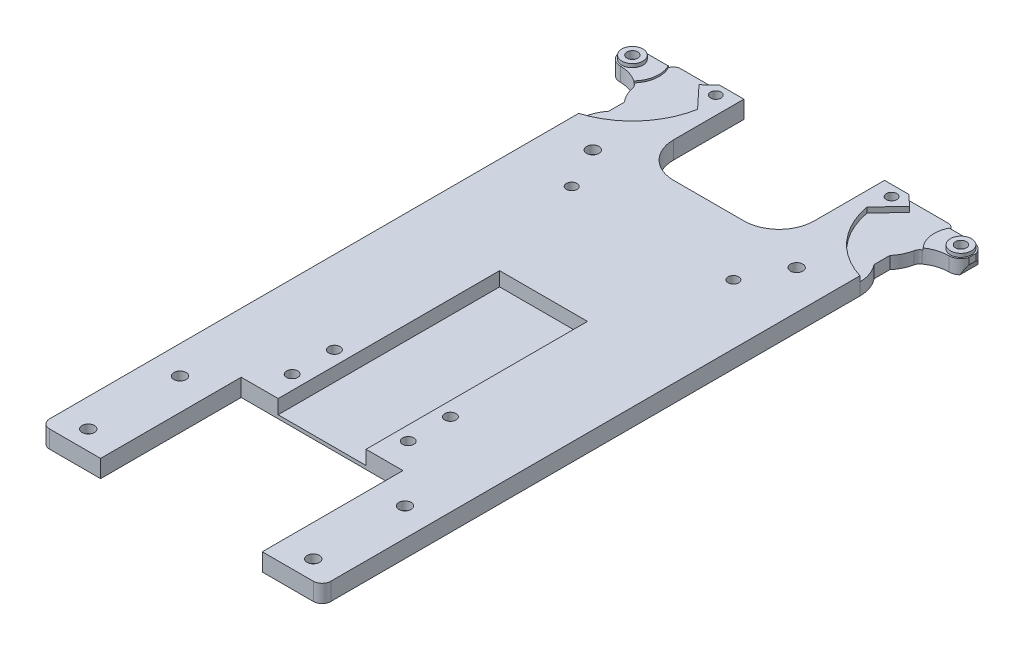
from build123d import *

# Parameters (mm, degrees)
SKETCH2_R                = 1.5
BOSS_EXTRUDE1_DEPTH      = 5
SKETCH3_W                = 10
SKETCH3_H                = 1.57
CUT_EXTRUDE1_DEPTH       = 10
FILLET1_R                = 2
FILLET2_R                = 2
SKETCH30_W               = 40
SKETCH30_H               = 30
CUT_EXTRUDE6_DEPTH       = 10
SKETCH34_W               = 12.902522411
SKETCH34_H               = 12
SKETCH34_W_2             = 12.902522412
CUT_EXTRUDE9_DEPTH       = 5
SKETCH35_W               = 6
SKETCH35_H               = 20
BOSS_EXTRUDE10_DEPTH     = 5
FILLET4_R                = 2.5
FILLET6_R                = 10
SKETCH37_W               = 46
SKETCH37_H               = 40
CUT_EXTRUDE10_DEPTH      = 10
SKETCH38_R               = 1.55
CUT_EXTRUDE11_DEPTH      = 10
SKETCH39_W               = 3.472321434
SKETCH39_H               = 3.475790073
SKETCH39_W_2             = 3.989706362
SKETCH39_H_2             = 4.304762261
BOSS_EXTRUDE11_DEPTH     = 5
SKETCH40_W               = 25
SKETCH40_H               = 63
CUT_EXTRUDE12_DEPTH      = 4
SKETCH41_R               = 1.75
CUT_EXTRUDE13_DEPTH      = 10
SKETCH42_W               = 4.480708693
SKETCH42_H               = 4.498944721
CUT_EXTRUDE14_DEPTH      = 10
FILLET7_R                = 10
FILLET8_R                = 10
SKETCH43_R               = 1.6
CUT_EXTRUDE15_DEPTH      = 10
CUT_EXTRUDE16_DEPTH      = 2.6
SKETCH45_R               = 16.824160508
SKETCH45_R_2             = 7.55
CUT_EXTRUDE17_DEPTH      = 1
CUT_EXTRUDE18_DEPTH      = 1
CUT_EXTRUDE18_DEPTH_BACK = 0.5
SKETCH46_R               = 7.602283071
SKETCH48_R               = 10
SKETCH48_R_2             = 3
CUT_EXTRUDE19_DEPTH      = 1
CHAMFER2_SIZE            = 1
CHAMFER2_SIZE2           = 2.144506921
BOSS_EXTRUDE13_START     = -3
SKETCH49_R               = 1.55
BOSS_EXTRUDE13_DEPTH     = 3


with BuildPart() as part:
    # Sketch2 → Boss-Extrude1 (new body)
    with BuildSketch(Plane(origin=(0, 0, 0), x_dir=(1, 0, 0), z_dir=(0, 1, 0))):
        Polygon((-93.717295423, 35.257358161), (6.282704577, 35.257358161), (6.282704577, 25.257358161), (-3.717295423, 25.257358161), (-3.717295423, -134.742641839), (6.282704577, -134.742641839), (6.282704577, -144.742641839), (-93.717295423, -144.742641839), (-93.717295423, -134.742641839), (-83.717295423, -134.742641839), (-83.717295423, 25.257358161), (-93.717295423, 25.257358161), align=None)
        with Locations(Location((-82.940217555, 30.257358161, 0), (0, 0, 270))):
            Circle(SKETCH2_R, mode=Mode.SUBTRACT)
        with Locations(Location((-4.49437329, 30.257358161, 0), (0, 0, 90))):
            Circle(SKETCH2_R, mode=Mode.SUBTRACT)
        with Locations(Location((-4.49437329, -139.742641839, 0), (0, 0, 270))):
            Circle(SKETCH2_R, mode=Mode.SUBTRACT)
        with Locations(Location((-82.940217555, -139.742641839, 0), (0, 0, 90))):
            Circle(SKETCH2_R, mode=Mode.SUBTRACT)
        with Locations(Location((-68.717295423, 32.257358161, 0), (0, 0, 270))):
            Circle(SKETCH2_R, mode=Mode.SUBTRACT)
        with Locations(Location((-18.717295423, 32.257358161, 0), (0, 0, 90))):
            Circle(SKETCH2_R, mode=Mode.SUBTRACT)
        with Locations(Location((-66.717295423, -10.742641839, 0), (0, 0, 270))):
            Circle(SKETCH2_R, mode=Mode.SUBTRACT)
        with Locations(Location((-20.717295423, -10.742641839, 0), (0, 0, 90))):
            Circle(SKETCH2_R, mode=Mode.SUBTRACT)
    extrude(amount=BOSS_EXTRUDE1_DEPTH)

    # Sketch3 → Cut-Extrude1 (cut)
    with BuildSketch(Plane(origin=(0, 5, 0), x_dir=(1, 0, 0), z_dir=(0, 1, 0))):
        with Locations((-88.717295423, 34.472358161)):
            Rectangle(SKETCH3_W, SKETCH3_H)
        with Locations((1.282704577, 34.472358161)):
            Rectangle(SKETCH3_W, SKETCH3_H)
    extrude(amount=-CUT_EXTRUDE1_DEPTH, mode=Mode.SUBTRACT)

    # Fillet1
    # the kernel refuses this fillet: 2 mm, written as the material it takes off along each edge
    with BuildSketch(Plane(origin=(-93.717295423, 10, -33.687358161), x_dir=(1, 0, 0), z_dir=(0, -1, 0)), Plane(origin=(6.282704577, 10, -33.687358161), x_dir=(0, 0, 1), z_dir=(0, -1, 0))) as fillet1_piece_1:
        with BuildLine():
            CenterArc((FILLET1_R, FILLET1_R), FILLET1_R, 180, 90)
            Line((0, FILLET1_R), (-FILLET1_R * 0.02, FILLET1_R))
            Line((-FILLET1_R * 0.02, FILLET1_R), (-FILLET1_R * 0.02, -FILLET1_R * 0.02))
            Line((-FILLET1_R * 0.02, -FILLET1_R * 0.02), (FILLET1_R, -FILLET1_R * 0.02))
            Line((FILLET1_R, -FILLET1_R * 0.02), (FILLET1_R, 0))
        make_face()
    extrude(amount=15, mode=Mode.SUBTRACT)
    with BuildSketch(Plane(origin=(-83.717295423, 9.883070243, -35.257358161), x_dir=(1, 0, 0), z_dir=(0, -1, 0))) as fillet1_piece_2:
        with BuildLine():
            CenterArc((1.953228097, 2), FILLET1_R, 192.415527305, 77.584472695)
            Line((0, 1.57), (-0.039064562, 1.5614))
            ThreePointArc((-0.039064562, 1.5614), (-0.04, 0.785), (-0.04, 0))
            Line((-0.04, 0), (0, -0.04))
            Line((0, -0.04), (1.953228097, -0.04))
            Line((1.953228097, -0.04), (1.953228097, 0))
        make_face()
    extrude(amount=14.766140486, mode=Mode.SUBTRACT)
    with BuildSketch(Plane(origin=(6.282704577, -5, -25.257358161), x_dir=(-1, 0, 0), z_dir=(0, 1, 0)), Plane(origin=(-93.717295423, -5, -25.257358161), x_dir=(0, 0, -1), z_dir=(0, 1, 0))) as fillet1_piece_3:
        with BuildLine():
            CenterArc((FILLET1_R, -FILLET1_R), FILLET1_R, 90, 90)
            Line((0, -FILLET1_R), (-FILLET1_R * 0.02, -FILLET1_R))
            Line((-FILLET1_R * 0.02, -FILLET1_R), (-FILLET1_R * 0.02, FILLET1_R * 0.02))
            Line((-FILLET1_R * 0.02, FILLET1_R * 0.02), (FILLET1_R, FILLET1_R * 0.02))
            Line((FILLET1_R, FILLET1_R * 0.02), (FILLET1_R, 0))
        make_face()
    extrude(amount=15, mode=Mode.SUBTRACT)
    with BuildSketch(Plane(origin=(-3.717295423, 9.883070243, -35.257358161), x_dir=(-1, 0, 0), z_dir=(0, -1, 0))) as fillet1_piece_4:
        with BuildLine():
            CenterArc((1.953228097, -2), FILLET1_R, 90, 77.584472695)
            Line((0, -1.57), (-0.039064562, -1.5614))
            ThreePointArc((-0.039064562, -1.5614), (-0.04, -0.785), (-0.04, 0))
            Line((-0.04, 0), (0, 0.04))
            Line((0, 0.04), (1.953228097, 0.04))
            Line((1.953228097, 0.04), (1.953228097, 0))
        make_face()
    extrude(amount=14.766140486, mode=Mode.SUBTRACT)

    # Fillet2
    fillet2_edges = [part.edges().sort_by_distance(p)[0] for p in [
        (-3.717295423, 2.5, -25.257358161),
        (-3.717295423, 2.5, 134.742641839),
        (6.282704577, 2.5, 134.742641839),
        (6.282704577, 2.5, 144.742641839),
        (-93.717295423, 2.5, 144.742641839),
        (-93.717295423, 2.5, 134.742641839),
        (-83.717295423, 2.5, 134.742641839),
        (-83.717295423, 2.5, -25.257358161),
    ]]
    fillet(fillet2_edges, radius=FILLET2_R)

    # Sketch30 → Cut-Extrude6 (cut)
    with BuildSketch(Plane(origin=(0, 5, 0), x_dir=(1, 0, 0), z_dir=(0, 1, 0))):
        with Locations((-43.717295423, 20.257358161)):
            Rectangle(SKETCH30_W, SKETCH30_H)
    extrude(amount=-CUT_EXTRUDE6_DEPTH, mode=Mode.SUBTRACT)

    # Sketch34 → Cut-Extrude9 (cut)
    with BuildSketch(Plane(origin=(0, 5, 0), x_dir=(1, 0, 0), z_dir=(0, 1, 0))):
        with Locations((-90.168556628, -138.742641839)):
            Rectangle(SKETCH34_W, SKETCH34_H)
        with Locations((2.733965783, -138.742641839)):
            Rectangle(SKETCH34_W_2, SKETCH34_H)
    extrude(amount=-CUT_EXTRUDE9_DEPTH, mode=Mode.SUBTRACT)

    # Sketch35 → Boss-Extrude10 (add)
    with BuildSketch(Plane(origin=(0, 5, 0), x_dir=(1, 0, 0), z_dir=(0, 1, 0))):
        with Locations((-80.717295423, -134.742641839)):
            Rectangle(SKETCH35_W, SKETCH35_H)
        with Locations((-6.717295423, -134.742641839)):
            Rectangle(SKETCH35_W, SKETCH35_H)
    extrude(amount=-BOSS_EXTRUDE10_DEPTH)

    # Fillet4
    fillet4_edges = [part.edges().sort_by_distance(p)[0] for p in [
        (-83.717295423, 2.5, 144.742641839),
        (-3.717295423, 2.5, 144.742641839),
    ]]
    fillet(fillet4_edges, radius=FILLET4_R)

    # Fillet6
    fillet6_edges = [part.edges().sort_by_distance(p)[0] for p in [
        (-23.717295423, 2.5, -5.257358161),
        (-63.717295423, 2.5, -5.257358161),
    ]]
    fillet(fillet6_edges, radius=FILLET6_R)

    # Sketch37 → Cut-Extrude10 (cut)
    with BuildSketch(Plane(origin=(0, 5, 0), x_dir=(1, 0, 0), z_dir=(0, 1, 0))):
        with Locations((-43.717295423, -124.742641839)):
            Rectangle(SKETCH37_W, SKETCH37_H)
    extrude(amount=-CUT_EXTRUDE10_DEPTH, mode=Mode.SUBTRACT)

    # Sketch38 → Cut-Extrude11 (cut)
    with BuildSketch(Plane(origin=(0, 5, 0), x_dir=(1, 0, 0), z_dir=(0, 1, 0))):
        with Locations(Location((3.015030313, 30.257358161, 0), (0, 0, 270))):
            Circle(SKETCH38_R)
        with Locations(Location((-90.449621159, 30.257358161, 0), (0, 0, 270))):
            Circle(SKETCH38_R)
    extrude(amount=-CUT_EXTRUDE11_DEPTH, mode=Mode.SUBTRACT)

    # Sketch39 → Boss-Extrude11 (add)
    with BuildSketch(Plane(origin=(0, 5, 0), x_dir=(1, 0, 0), z_dir=(0, 1, 0))):
        with Locations((-82.940217555, 30.257358161)):
            Rectangle(SKETCH39_W, SKETCH39_H)
        with Locations((-4.49437329, 30.257358161)):
            Rectangle(SKETCH39_W_2, SKETCH39_H_2)
    extrude(amount=-BOSS_EXTRUDE11_DEPTH)

    # Sketch40 → Cut-Extrude12 (cut)
    with BuildSketch(Plane(origin=(0, 5, 0), x_dir=(1, 0, 0), z_dir=(0, 1, 0))):
        with Locations((-43.717295423, -73.242641839)):
            Rectangle(SKETCH40_W, SKETCH40_H)
    extrude(amount=-CUT_EXTRUDE12_DEPTH, mode=Mode.SUBTRACT)

    # Sketch41 → Cut-Extrude13 (cut)
    with BuildSketch(Plane.XZ):
        with Locations(Location((-11.717295423, 139.242641839, 0), (0, 0, 270))):
            Circle(SKETCH41_R)
        with Locations(Location((-11.717295423, 113.152641839, 0), (0, 0, 270))):
            Circle(SKETCH41_R)
        with Locations(Location((-75.717295423, 139.242641839, 0), (0, 0, 270))):
            Circle(SKETCH41_R)
        with Locations(Location((-75.717295423, 113.152641839, 0), (0, 0, 270))):
            Circle(SKETCH41_R)
        with Locations(Location((-72.717295423, -1.257358161, 0), (0, 0, 270))):
            Circle(SKETCH41_R)
        with Locations(Location((-14.717295423, -1.257358161, 0), (0, 0, 270))):
            Circle(SKETCH41_R)
    extrude(amount=-CUT_EXTRUDE13_DEPTH, mode=Mode.SUBTRACT)

    # Sketch42 → Cut-Extrude14 (cut)
    with BuildSketch(Plane(origin=(0, 0, 0), x_dir=(-1, 0, 0), z_dir=(0, -1, 0))):
        with BuildLine():
            Line((3.095802805, 24.706398324), (-10.592603026, 24.930616082))
            Line((-10.592603026, 24.930616082), (-9.048133228, 35.579328899))
            Line((-9.048133228, 35.579328899), (-3.015030313, 33.687358161))
            ThreePointArc((-3.015030313, 33.687358161), (-6.445030313, 30.257358161), (-3.015030313, 26.827358161))
            ThreePointArc((-3.015030313, 26.827358161), (0.219191078, 26.282044287), (3.095802805, 24.706398324))
        make_face()
        with BuildLine():
            Line((98.027193871, 24.930616082), (96.482724074, 35.579328899))
            Line((96.482724074, 35.579328899), (90.449621159, 33.687358161))
            ThreePointArc((90.449621159, 33.687358161), (93.879621159, 30.257358161), (90.449621159, 26.827358161))
            ThreePointArc((90.449621159, 26.827358161), (87.215399767, 26.282044287), (84.33878804, 24.706398324))
            Line((84.33878804, 24.706398324), (98.027193871, 24.930616082))
        make_face()
        with Locations((3.717295423, 16.766649006)):
            Rectangle(SKETCH42_W, SKETCH42_H)
        with Locations((83.717295423, 16.766649006)):
            Rectangle(SKETCH42_W, SKETCH42_H)
    extrude(amount=-CUT_EXTRUDE14_DEPTH, mode=Mode.SUBTRACT)

    # Fillet7
    # the kernel refuses this fillet: 10 mm, written as the material it takes off along each edge
    with BuildSketch(Plane(origin=(-3.717295423, -11.578374765, -19.016121367), x_dir=(-1, 0, 0), z_dir=(0, 1, 0))) as fillet7_piece_1:
        with BuildLine():
            CenterArc((9.769693723, -6.580961066), FILLET7_R, 138.8451678, 29.911450873)
            Line((-0.03838438, -4.631190839), (-1.01919219, -4.436213817))
            ThreePointArc((-1.01919219, -4.436213817), (-1, -4.241236794), (-1, 0))
            Line((-1, 0), (0, 1))
            ThreePointArc((0, 1), (1.120177173, 1), (1.487420409, 0.658096107))
            Line((1.487420409, 0.658096107), (2.240354347, 0))
        make_face()
    extrude(amount=28.156749529, mode=Mode.SUBTRACT)
    with BuildSketch(Plane(origin=(-3.717295423, 20.769412508, -14.517176646), x_dir=(0, 0, 1), z_dir=(0, -1, 0))) as fillet7_piece_2:
        with BuildLine():
            CenterArc((6.307765003, 10), FILLET7_R, 230.892565417, 39.107434583)
            Line((0, 2.240354347), (0, 0))
            Line((0, 0), (6.307765003, 0))
        make_face()
    extrude(amount=36.538825015, mode=Mode.SUBTRACT)

    # Fillet8
    # the kernel refuses this fillet: 10 mm, written as the material it takes off along each edge
    with BuildSketch(Plane(origin=(-83.717295423, -11.578374765, -19.016121367), x_dir=(-0.008287946347409775, 0, -0.9999656543828606), z_dir=(0, 1, 0))) as fillet8_piece_1:
        with BuildLine():
            CenterArc((6.499764342, -9.823900829), FILLET8_R, 100.768511544, 29.911450873)
            Line((-0.018567937, -2.2402774), (-0.670401164, -1.481915057))
            ThreePointArc((-0.670401164, -1.481915057), (-1.009249623, -1.111850754), (-0.999965654, 0.008287946))
            Line((-0.999965654, 0.008287946), (0.008287946, 0.999965654))
            ThreePointArc((0.008287946, 0.999965654), (4.249379072, 0.964814511), (4.444508462, 0.982390083))
            Line((4.444508462, 0.982390083), (4.631349906, 0))
        make_face()
    extrude(amount=28.156749529, mode=Mode.SUBTRACT)
    with BuildSketch(Plane(origin=(-83.717295423, 20.769412508, -14.517176646), x_dir=(1, 0, 0), z_dir=(0, -1, 0))) as fillet8_piece_2:
        with BuildLine():
            CenterArc((10, 6.307765003), FILLET8_R, 180, 39.107434583)
            Line((0, 6.307765003), (0, 0))
            Line((0, 0), (2.240354347, 0))
        make_face()
    extrude(amount=36.538825015, mode=Mode.SUBTRACT)

    # Sketch43 → Cut-Extrude15 (cut)
    with BuildSketch(Plane(origin=(0, 5, 0), x_dir=(1, 0, 0), z_dir=(0, 1, 0))):
        with Locations(Location((-27.217295423, -96.742641839, 0), (0, 0, 270))):
            Circle(SKETCH43_R)
        with Locations(Location((-27.217295423, -84.742641839, 0), (0, 0, 270))):
            Circle(SKETCH43_R)
        with Locations(Location((-60.217295423, -96.742641839, 0), (0, 0, 90))):
            Circle(SKETCH43_R)
        with Locations(Location((-60.217295423, -84.742641839, 0), (0, 0, 90))):
            Circle(SKETCH43_R)
    extrude(amount=-CUT_EXTRUDE15_DEPTH, mode=Mode.SUBTRACT)

    # Sketch44 → Cut-Extrude16 (cut)
    with BuildSketch(Plane.XZ):
        Polygon((-72.426398888, 139.242641839), (-74.071847155, 142.092641839), (-77.36274369, 142.092641839), (-79.008191957, 139.242641839), (-77.36274369, 136.392641839), (-74.071847155, 136.392641839), align=None)
        Polygon((-72.426398888, 113.152641839), (-74.071847155, 116.002641839), (-77.36274369, 116.002641839), (-79.008191957, 113.152641839), (-77.36274369, 110.302641839), (-74.071847155, 110.302641839), align=None)
        Polygon((-56.926398888, 96.742641839), (-58.571847155, 99.592641839), (-61.86274369, 99.592641839), (-63.508191957, 96.742641839), (-61.86274369, 93.892641839), (-58.571847155, 93.892641839), align=None)
        Polygon((-56.926398888, 84.742641839), (-58.571847155, 87.592641839), (-61.86274369, 87.592641839), (-63.508191957, 84.742641839), (-61.86274369, 81.892641839), (-58.571847155, 81.892641839), align=None)
        Polygon((-69.426398888, -1.257358161), (-71.071847155, 1.592641839), (-74.36274369, 1.592641839), (-76.008191957, -1.257358161), (-74.36274369, -4.107358161), (-71.071847155, -4.107358161), align=None)
        Polygon((-65.426398888, -32.257358161), (-67.071847155, -29.407358161), (-70.36274369, -29.407358161), (-72.008191957, -32.257358161), (-70.36274369, -35.107358161), (-67.071847155, -35.107358161), align=None)
        Polygon((-20.36274369, -35.107358161), (-22.008191957, -32.257358161), (-20.36274369, -29.407358161), (-17.071847155, -29.407358161), (-15.426398888, -32.257358161), (-17.071847155, -35.107358161), align=None)
        Polygon((-16.36274369, -4.107358161), (-18.008191957, -1.257358161), (-16.36274369, 1.592641839), (-13.071847155, 1.592641839), (-11.426398888, -1.257358161), (-13.071847155, -4.107358161), align=None)
        Polygon((-28.86274369, 81.892641839), (-30.508191957, 84.742641839), (-28.86274369, 87.592641839), (-25.571847155, 87.592641839), (-23.926398888, 84.742641839), (-25.571847155, 81.892641839), align=None)
        Polygon((-28.86274369, 93.892641839), (-30.508191957, 96.742641839), (-28.86274369, 99.592641839), (-25.571847155, 99.592641839), (-23.926398888, 96.742641839), (-25.571847155, 93.892641839), align=None)
        Polygon((-13.36274369, 110.302641839), (-15.008191957, 113.152641839), (-13.36274369, 116.002641839), (-10.071847155, 116.002641839), (-8.426398888, 113.152641839), (-10.071847155, 110.302641839), align=None)
        Polygon((-13.36274369, 136.392641839), (-15.008191957, 139.242641839), (-13.36274369, 142.092641839), (-10.071847155, 142.092641839), (-8.426398888, 139.242641839), (-10.071847155, 136.392641839), align=None)
    extrude(amount=-CUT_EXTRUDE16_DEPTH, mode=Mode.SUBTRACT)

    # Sketch45 → Cut-Extrude17 (cut)
    # profile 1 of 2: a face of its own
    with BuildSketch(Plane(origin=(0, 5, 0), x_dir=(1, 0, 0), z_dir=(0, 1, 0))):
        with Locations((-90.449621159, 30.257358161)):
            Circle(SKETCH45_R)
        with Locations((-90.449621159, 30.257358161)):
            Circle(SKETCH45_R_2, mode=Mode.SUBTRACT)
    # profile 2 of 2: a face of its own
    with BuildSketch(Plane(origin=(0, 5, 0), x_dir=(1, 0, 0), z_dir=(0, 1, 0))):
        with Locations((3.015030313, 30.257358161)):
            Circle(SKETCH45_R)
        with Locations((3.015030313, 30.257358161)):
            Circle(SKETCH45_R_2, mode=Mode.SUBTRACT)
    extrude(amount=-CUT_EXTRUDE17_DEPTH, mode=Mode.SUBTRACT)

    # Sketch46 → Cut-Extrude18 (cut, two sides: drawn at the far end of the back side and taken through both)
    # profile 1 of 2: a face of its own
    with BuildSketch(Plane(origin=(0, 4, 0), x_dir=(1, 0, 0), z_dir=(0, 1, 0)).offset(-CUT_EXTRUDE18_DEPTH_BACK)):
        with BuildLine():
            Line((-67.808867571, 26.151938687), (-73.664044466, 32.4296193))
            Line((-73.664044466, 32.4296193), (-68.520569196, 37.226925729))
            ThreePointArc((-68.520569196, 37.226925729), (-113.412215224, 28.781734266), (-67.808867571, 26.151938687))
        make_face()
        with Locations((-90.449621159, 30.257358161)):
            Circle(SKETCH46_R, mode=Mode.SUBTRACT)
    # profile 2 of 2: a face of its own
    with BuildSketch(Plane(origin=(0, 4, 0), x_dir=(1, 0, 0), z_dir=(0, 1, 0)).offset(-CUT_EXTRUDE18_DEPTH_BACK)):
        with BuildLine():
            Line((-13.770546379, 32.4296193), (-18.914021649, 37.226925729))
            ThreePointArc((-18.914021649, 37.226925729), (25.977624379, 28.781734266), (-19.625723274, 26.151938687))
            Line((-19.625723274, 26.151938687), (-13.770546379, 32.4296193))
        make_face()
        with Locations((3.015030313, 30.257358161)):
            Circle(SKETCH46_R, mode=Mode.SUBTRACT)
    extrude(amount=CUT_EXTRUDE18_DEPTH + CUT_EXTRUDE18_DEPTH_BACK, mode=Mode.SUBTRACT)

    # Sketch48 → Cut-Extrude19 (cut)
    # profile 1 of 2: a face of its own
    with BuildSketch(Plane(origin=(0, 5, 0), x_dir=(1, 0, 0), z_dir=(0, 1, 0))):
        with Locations((-90.449621159, 30.257358161)):
            Circle(SKETCH48_R)
        with Locations(Location((-90.449621159, 30.257358161, 0), (0, 0, 270))):
            Circle(SKETCH48_R_2, mode=Mode.SUBTRACT)
    # profile 2 of 2: a face of its own
    with BuildSketch(Plane(origin=(0, 5, 0), x_dir=(1, 0, 0), z_dir=(0, 1, 0))):
        with Locations((3.015030313, 30.257358161)):
            Circle(SKETCH48_R)
        with Locations(Location((3.015030313, 30.257358161, 0), (0, 0, 270))):
            Circle(SKETCH48_R_2, mode=Mode.SUBTRACT)
    extrude(amount=-CUT_EXTRUDE19_DEPTH, mode=Mode.SUBTRACT)

    # SurfaceCut1
    split(bisect_by=Plane.ZY.offset(43.717295423), keep=Keep.BOTTOM)

    # Chamfer2
    chamfer2_edges = [part.edges().sort_by_distance(p)[0] for p in [
        (6.282704577, 0, -30.257358161),
    ]]
    chamfer2_side = [part.faces().sort_by_distance(p)[0] for p in [
        (-21.202869184, 0, 49.987320856),
    ]]
    chamfer(chamfer2_edges, length=CHAMFER2_SIZE, length2=CHAMFER2_SIZE2, reference=chamfer2_side[0])

    # Sketch49 → Boss-Extrude13 (add)
    with BuildSketch(Plane.XZ.offset(BOSS_EXTRUDE13_START)):
        with Locations(Location((3.015030313, -30.257358161, 0), (0, 0, 90))):
            Circle(SKETCH49_R)
    extrude(amount=BOSS_EXTRUDE13_DEPTH)

    # Sketch50 → Cut-Revolve1 (revolve, cut)
    with BuildSketch(Plane(origin=(3.012704577, 0, 0), x_dir=(0, 0, -1), z_dir=(1, 0, 0)), mode=Mode.PRIVATE) as cut_revolve1_sk:
        Polygon((30.257358161, 3), (30.257358161, 1), (31.707358161, 1), (31.807358161, 3), align=None)
    revolve(cut_revolve1_sk.sketch.rotate(Axis((3.012704577, 3, -30.257358161), (0, -1, 0)), 180), axis=Axis((3.012704577, 3, -30.257358161), (0, -1, 0)), mode=Mode.SUBTRACT)

    # Mirror1: part across plane


with BuildPart() as part_1:
    add(part.part)
    add(part.part.mirror(Plane.ZY.offset(43.717295423)))


solid = part_1.part
